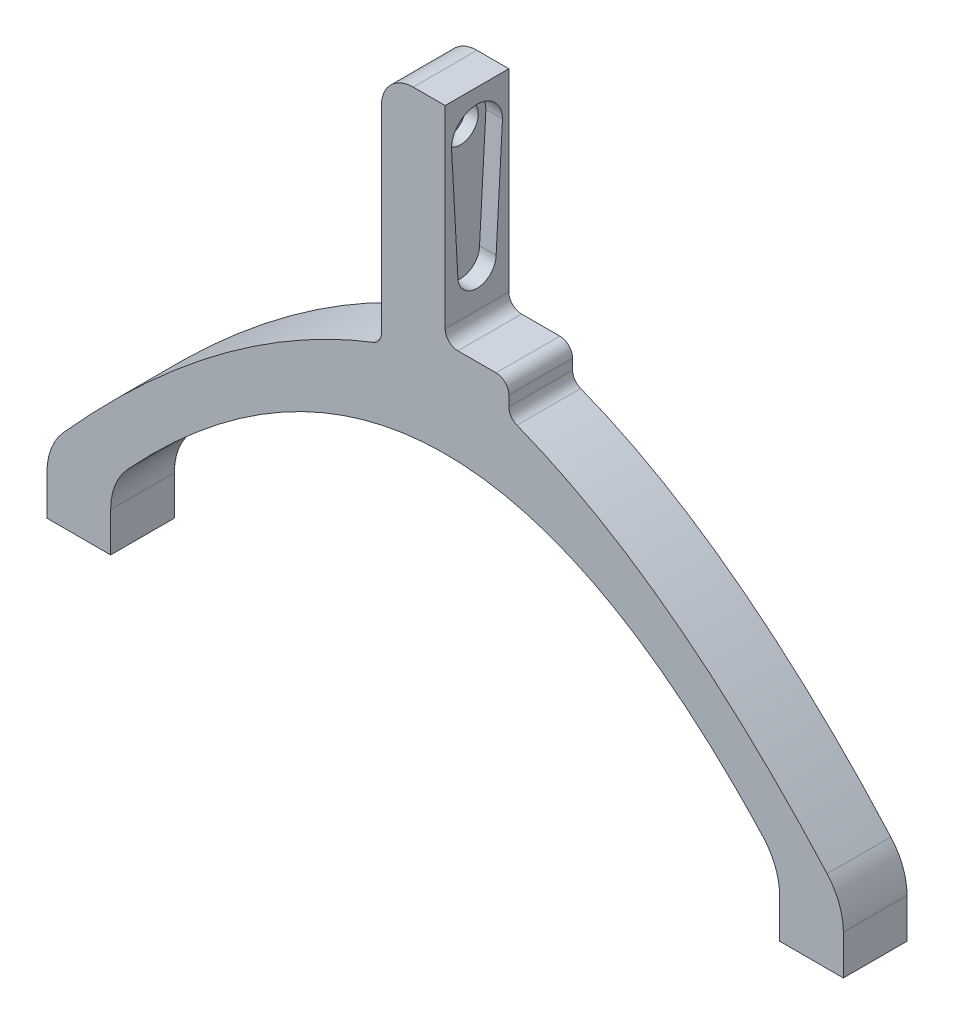
from build123d import *

# Parameters (mm, degrees)
SKETCH1_W                = 290
SKETCH1_H                = 260
BOSS_EXTRUDE1_DEPTH      = 8
BOSS_EXTRUDE2_DEPTH      = 6
CHAMFER1_SIZE            = 5
CHAMFER1_SIZE_2          = 6.399708161
SKETCH3_R                = 1.6
CUT_EXTRUDE1_DEPTH       = 5
SKETCH4_W                = 15
SKETCH4_H                = 25
SKETCH4_R                = 1.6
SKETCH4_W_2              = 25
SKETCH4_H_2              = 15
BOSS_EXTRUDE3_DEPTH      = 5
CUT_EXTRUDE2_DEPTH       = 0.25
BOSS_EXTRUDE4_DEPTH      = 7.5
BOSS_EXTRUDE4_DEPTH_BACK = 7.5
FILLET1_R                = 10
SKETCH7_R                = 2
SKETCH7_R_2              = 0.5
CUT_EXTRUDE3_DEPTH       = 8
SKETCH8_W                = 10
SKETCH8_H                = 10
BOSS_EXTRUDE5_DEPTH      = 10
BOSS_EXTRUDE6_DEPTH      = 10
FILLET2_R                = 10
SKETCH11_W               = 10
SKETCH11_H               = 32.342254785
CUT_EXTRUDE4_DEPTH       = 10
FILLET3_R                = 2
CUT_EXTRUDE6_DEPTH       = 2.6
FILLET4_R                = 5
SKETCH13_W               = 669.627497736
SKETCH13_H               = 418.517186084
CUT_EXTRUDE7_DEPTH       = 85
BOSS_EXTRUDE7_DEPTH      = 2
CUT_EXTRUDE8_DEPTH       = 2
CUT_EXTRUDE9_DEPTH       = 2.8
CUT_EXTRUDE10_DEPTH      = 8


with BuildPart() as part:
    # Sketch1 → Boss-Extrude1 (new body)
    with BuildSketch(Plane(origin=(0, 0, 0), x_dir=(1, 0, 0), z_dir=(0, 1, 0))):
        Rectangle(SKETCH1_W, SKETCH1_H)
        Polygon((-52.5, 130), (0, 130), (0, 160), (-22.5, 160), align=None)
        Polygon((0, 160), (0, 130), (52.5, 130), (22.5, 160), align=None)
    extrude(amount=BOSS_EXTRUDE1_DEPTH)

    # Sketch2 → Boss-Extrude2 (add)
    with BuildSketch(Plane(origin=(0, 8, 0), x_dir=(1, 0, 0), z_dir=(0, 1, 0))):
        Polygon((27.564101615, 25.4), (25.832050808, 28.4), (22.367949192, 28.4), (20.635898385, 25.4), (22.367949192, 22.4), (25.832050808, 22.4), align=None)
        Polygon((-20.635898385, 26.7), (-22.367949192, 29.7), (-25.832050808, 29.7), (-27.564101615, 26.7), (-25.832050808, 23.7), (-22.367949192, 23.7), align=None)
        Polygon((-15.535898385, -25.4), (-17.267949192, -22.4), (-20.732050808, -22.4), (-22.464101615, -25.4), (-20.732050808, -28.4), (-17.267949192, -28.4), align=None)
        Polygon((12.364101615, -25.4), (10.632050808, -22.4), (7.167949192, -22.4), (5.435898385, -25.4), (7.167949192, -28.4), (10.632050808, -28.4), align=None)
    extrude(amount=BOSS_EXTRUDE2_DEPTH)

    # Chamfer1
    # the kernel refuses this chamfer: 6.399708161, 5 mm, written as the material it adds along each edge
    with BuildSketch(Plane(origin=(-2.818240039, 8, 11.103412877), x_dir=(-0.8660254037844387, 0, 0.5), z_dir=(0.5, 0, 0.8660254037844387))) as chamfer1_piece_1_section:
        Polygon((CHAMFER1_SIZE, 0), (0, -CHAMFER1_SIZE_2), (0, 0), align=None)
    chamfer1_piece_1 = extrude(amount=36.480655312, mode=Mode.PRIVATE)
    chamfer1_piece_1 = split(chamfer1_piece_1, bisect_by=Plane(origin=(-2.818240039, 14, 11.103412877), z_dir=(0, -1, 0)), keep=Keep.TOP, mode=Mode.PRIVATE)
    chamfer1_piece_1 = split(chamfer1_piece_1, bisect_by=Plane(origin=(2.181166612, 3.489780623, 13.989821652), z_dir=(0.6824373310787425, -0.6156614753256566, 0.3940053768033616)), keep=Keep.TOP, mode=Mode.PRIVATE)
    chamfer1_piece_1 = split(chamfer1_piece_1, bisect_by=Plane(origin=(-2.818240039, 18.817141598, 24.948722749), z_dir=(0, -0.6156614753256563, -0.7880107536067237)), keep=Keep.TOP, mode=Mode.PRIVATE)
    add(chamfer1_piece_1)
    with BuildSketch(Plane(origin=(15.422087617, 8, 8.103412877), x_dir=(-0.8660254037844387, 0, -0.4999999999999999), z_dir=(-0.4999999999999999, 0, 0.8660254037844388))) as chamfer1_piece_2_section:
        Polygon((CHAMFER1_SIZE, 0), (0, -CHAMFER1_SIZE_2), (0, 0), align=None)
    chamfer1_piece_2 = extrude(amount=36.480655312, mode=Mode.PRIVATE)
    chamfer1_piece_2 = split(chamfer1_piece_2, bisect_by=Plane(origin=(15.422087617, 14, 8.103412877), z_dir=(0, -1, 0)), keep=Keep.TOP, mode=Mode.PRIVATE)
    chamfer1_piece_2 = split(chamfer1_piece_2, bisect_by=Plane(origin=(15.422087617, 3.489780623, 13.876230428), z_dir=(0, -0.6156614753256565, 0.7880107536067235)), keep=Keep.TOP, mode=Mode.PRIVATE)
    chamfer1_piece_2 = split(chamfer1_piece_2, bisect_by=Plane(origin=(3.431697543, 18.817141598, 15.026067813), z_dir=(0.6824373310787425, -0.6156614753256566, -0.3940053768033616)), keep=Keep.TOP, mode=Mode.PRIVATE)
    add(chamfer1_piece_2)
    with BuildSketch(Plane(origin=(27.140327656, 8, 22.4), x_dir=(0, 0, -1), z_dir=(-1, 0, 0))) as chamfer1_piece_3_section:
        Polygon((CHAMFER1_SIZE, 0), (0, -CHAMFER1_SIZE_2), (0, 0), align=None)
    chamfer1_piece_3 = extrude(amount=36.480655312, mode=Mode.PRIVATE)
    chamfer1_piece_3 = split(chamfer1_piece_3, bisect_by=Plane(origin=(27.140327656, 14, 22.4), z_dir=(0, -1, 0)), keep=Keep.TOP, mode=Mode.PRIVATE)
    chamfer1_piece_3 = split(chamfer1_piece_3, bisect_by=Plane(origin=(22.140921005, 3.489780623, 25.286408776), z_dir=(-0.6824373310787424, -0.6156614753256568, 0.39400537680336145)), keep=Keep.TOP, mode=Mode.PRIVATE)
    chamfer1_piece_3 = split(chamfer1_piece_3, bisect_by=Plane(origin=(15.149937583, 18.817141598, 15.477345064), z_dir=(0.6824373310787425, -0.6156614753256566, 0.3940053768033616)), keep=Keep.TOP, mode=Mode.PRIVATE)
    add(chamfer1_piece_3)
    with BuildSketch(Plane(origin=(20.618240039, 8, 39.696587123), x_dir=(0.8660254037844387, 0, -0.49999999999999983), z_dir=(-0.4999999999999998, 0, -0.8660254037844388))) as chamfer1_piece_4_section:
        Polygon((CHAMFER1_SIZE, 0), (0, -CHAMFER1_SIZE_2), (0, 0), align=None)
    chamfer1_piece_4 = extrude(amount=36.480655312, mode=Mode.PRIVATE)
    chamfer1_piece_4 = split(chamfer1_piece_4, bisect_by=Plane(origin=(20.618240039, 14, 39.696587123), z_dir=(0, -1, 0)), keep=Keep.TOP, mode=Mode.PRIVATE)
    chamfer1_piece_4 = split(chamfer1_piece_4, bisect_by=Plane(origin=(20.618240039, 18.817141598, 25.851277251), z_dir=(0, -0.6156614753256565, 0.7880107536067235)), keep=Keep.TOP, mode=Mode.PRIVATE)
    chamfer1_piece_4 = split(chamfer1_piece_4, bisect_by=Plane(origin=(15.618833388, 3.489780623, 36.810178348), z_dir=(-0.6824373310787425, -0.6156614753256566, -0.39400537680336156)), keep=Keep.TOP, mode=Mode.PRIVATE)
    add(chamfer1_piece_4)
    with BuildSketch(Plane(origin=(2.377912383, 8, 42.696587123), x_dir=(0.8660254037844387, 0, 0.4999999999999999), z_dir=(0.4999999999999999, 0, -0.8660254037844388))) as chamfer1_piece_5_section:
        Polygon((CHAMFER1_SIZE, 0), (0, -CHAMFER1_SIZE_2), (0, 0), align=None)
    chamfer1_piece_5 = extrude(amount=36.480655312, mode=Mode.PRIVATE)
    chamfer1_piece_5 = split(chamfer1_piece_5, bisect_by=Plane(origin=(2.377912383, 14, 42.696587123), z_dir=(0, -1, 0)), keep=Keep.TOP, mode=Mode.PRIVATE)
    chamfer1_piece_5 = split(chamfer1_piece_5, bisect_by=Plane(origin=(14.368302457, 18.817141598, 35.773932187), z_dir=(-0.6824373310787424, -0.6156614753256568, 0.39400537680336145)), keep=Keep.TOP, mode=Mode.PRIVATE)
    chamfer1_piece_5 = split(chamfer1_piece_5, bisect_by=Plane(origin=(2.377912383, 3.489780623, 36.923769572), z_dir=(0, -0.6156614753256563, -0.7880107536067237)), keep=Keep.TOP, mode=Mode.PRIVATE)
    add(chamfer1_piece_5)
    with BuildSketch(Plane(origin=(-9.340327656, 8, 28.4), x_dir=(0, 0, 1), z_dir=(1, 0, 0))) as chamfer1_piece_6_section:
        Polygon((CHAMFER1_SIZE, 0), (0, -CHAMFER1_SIZE_2), (0, 0), align=None)
    chamfer1_piece_6 = extrude(amount=36.480655312, mode=Mode.PRIVATE)
    chamfer1_piece_6 = split(chamfer1_piece_6, bisect_by=Plane(origin=(-9.340327656, 14, 28.4), z_dir=(0, -1, 0)), keep=Keep.TOP, mode=Mode.PRIVATE)
    chamfer1_piece_6 = split(chamfer1_piece_6, bisect_by=Plane(origin=(-4.340921005, 3.489780623, 25.513591224), z_dir=(0.6824373310787425, -0.6156614753256566, -0.3940053768033616)), keep=Keep.TOP, mode=Mode.PRIVATE)
    chamfer1_piece_6 = split(chamfer1_piece_6, bisect_by=Plane(origin=(2.650062417, 18.817141598, 35.322654936), z_dir=(-0.6824373310787425, -0.6156614753256566, -0.39400537680336156)), keep=Keep.TOP, mode=Mode.PRIVATE)
    add(chamfer1_piece_6)
    with BuildSketch(Plane(origin=(-37.240327656, 8, 28.4), x_dir=(0, 0, 1), z_dir=(1, 0, 0))) as chamfer1_piece_7_section:
        Polygon((CHAMFER1_SIZE, 0), (0, -CHAMFER1_SIZE_2), (0, 0), align=None)
    chamfer1_piece_7 = extrude(amount=36.480655312, mode=Mode.PRIVATE)
    chamfer1_piece_7 = split(chamfer1_piece_7, bisect_by=Plane(origin=(-37.240327656, 14, 28.4), z_dir=(0, -1, 0)), keep=Keep.TOP, mode=Mode.PRIVATE)
    chamfer1_piece_7 = split(chamfer1_piece_7, bisect_by=Plane(origin=(-25.249937583, 18.817141598, 35.322654936), z_dir=(-0.6824373310786762, -0.6156614753256564, -0.3940053768034766)), keep=Keep.TOP, mode=Mode.PRIVATE)
    chamfer1_piece_7 = split(chamfer1_piece_7, bisect_by=Plane(origin=(-32.240921005, 3.489780623, 25.513591224), z_dir=(0.6824373310787202, -0.6156614753256564, -0.3940053768034006)), keep=Keep.TOP, mode=Mode.PRIVATE)
    add(chamfer1_piece_7)
    with BuildSketch(Plane(origin=(-25.522087617, 8, 42.696587123), x_dir=(0.8660254037843544, 0, 0.5000000000001458), z_dir=(0.5000000000001458, 0, -0.8660254037843546))) as chamfer1_piece_8_section:
        Polygon((CHAMFER1_SIZE, 0), (0, -CHAMFER1_SIZE_2), (0, 0), align=None)
    chamfer1_piece_8 = extrude(amount=36.480655312, mode=Mode.PRIVATE)
    chamfer1_piece_8 = split(chamfer1_piece_8, bisect_by=Plane(origin=(-25.522087617, 14, 42.696587123), z_dir=(0, -1, 0)), keep=Keep.TOP, mode=Mode.PRIVATE)
    chamfer1_piece_8 = split(chamfer1_piece_8, bisect_by=Plane(origin=(-25.522087617, 3.489780623, 36.923769572), z_dir=(0, -0.6156614753256567, -0.7880107536067232)), keep=Keep.TOP, mode=Mode.PRIVATE)
    chamfer1_piece_8 = split(chamfer1_piece_8, bisect_by=Plane(origin=(-13.531697543, 18.817141598, 35.773932187), z_dir=(-0.6824373310787424, -0.6156614753256564, 0.39400537680336184)), keep=Keep.TOP, mode=Mode.PRIVATE)
    add(chamfer1_piece_8)
    with BuildSketch(Plane(origin=(-7.281759961, 8, 39.696587123), x_dir=(0.8660254037844386, 0, -0.5000000000000001), z_dir=(-0.5000000000000001, 0, -0.8660254037844386))) as chamfer1_piece_9_section:
        Polygon((CHAMFER1_SIZE, 0), (0, -CHAMFER1_SIZE_2), (0, 0), align=None)
    chamfer1_piece_9 = extrude(amount=36.480655312, mode=Mode.PRIVATE)
    chamfer1_piece_9 = split(chamfer1_piece_9, bisect_by=Plane(origin=(-7.281759961, 14, 39.696587123), z_dir=(0, -1, 0)), keep=Keep.TOP, mode=Mode.PRIVATE)
    chamfer1_piece_9 = split(chamfer1_piece_9, bisect_by=Plane(origin=(-12.281166612, 3.489780623, 36.810178348), z_dir=(-0.6824373310786762, -0.6156614753256564, -0.3940053768034766)), keep=Keep.TOP, mode=Mode.PRIVATE)
    chamfer1_piece_9 = split(chamfer1_piece_9, bisect_by=Plane(origin=(-7.281759961, 18.817141598, 25.851277251), z_dir=(1.6163362940315776e-14, -0.6156614753256565, 0.7880107536067235)), keep=Keep.TOP, mode=Mode.PRIVATE)
    add(chamfer1_piece_9)
    with BuildSketch(Plane(origin=(-0.759672344, 8, 22.4), x_dir=(0, 0, -1), z_dir=(-1, 0, 0))) as chamfer1_piece_10_section:
        Polygon((CHAMFER1_SIZE, 0), (0, -CHAMFER1_SIZE_2), (0, 0), align=None)
    chamfer1_piece_10 = extrude(amount=36.480655312, mode=Mode.PRIVATE)
    chamfer1_piece_10 = split(chamfer1_piece_10, bisect_by=Plane(origin=(-0.759672344, 14, 22.4), z_dir=(0, -1, 0)), keep=Keep.TOP, mode=Mode.PRIVATE)
    chamfer1_piece_10 = split(chamfer1_piece_10, bisect_by=Plane(origin=(-5.759078995, 3.489780623, 25.286408776), z_dir=(-0.6824373310787424, -0.6156614753256564, 0.39400537680336184)), keep=Keep.TOP, mode=Mode.PRIVATE)
    chamfer1_piece_10 = split(chamfer1_piece_10, bisect_by=Plane(origin=(-12.750062417, 18.817141598, 15.477345064), z_dir=(0.6824373310787266, -0.6156614753256564, 0.3940053768033893)), keep=Keep.TOP, mode=Mode.PRIVATE)
    add(chamfer1_piece_10)
    with BuildSketch(Plane(origin=(-12.477912383, 8, 8.103412877), x_dir=(-0.8660254037844184, 0, -0.500000000000035), z_dir=(-0.500000000000035, 0, 0.8660254037844185))) as chamfer1_piece_11_section:
        Polygon((CHAMFER1_SIZE, 0), (0, -CHAMFER1_SIZE_2), (0, 0), align=None)
    chamfer1_piece_11 = extrude(amount=36.480655312, mode=Mode.PRIVATE)
    chamfer1_piece_11 = split(chamfer1_piece_11, bisect_by=Plane(origin=(-12.477912383, 14, 8.103412877), z_dir=(0, -1, 0)), keep=Keep.TOP, mode=Mode.PRIVATE)
    chamfer1_piece_11 = split(chamfer1_piece_11, bisect_by=Plane(origin=(-12.477912383, 3.489780623, 13.876230428), z_dir=(1.6163362940315776e-14, -0.6156614753256565, 0.7880107536067235)), keep=Keep.TOP, mode=Mode.PRIVATE)
    chamfer1_piece_11 = split(chamfer1_piece_11, bisect_by=Plane(origin=(-24.468302457, 18.817141598, 15.026067813), z_dir=(0.6824373310787202, -0.6156614753256564, -0.3940053768034006)), keep=Keep.TOP, mode=Mode.PRIVATE)
    add(chamfer1_piece_11)
    with BuildSketch(Plane(origin=(-30.718240039, 8, 11.103412877), x_dir=(-0.8660254037844104, 0, 0.5000000000000491), z_dir=(0.5000000000000491, 0, 0.8660254037844103))) as chamfer1_piece_12_section:
        Polygon((CHAMFER1_SIZE, 0), (0, -CHAMFER1_SIZE_2), (0, 0), align=None)
    chamfer1_piece_12 = extrude(amount=36.480655312, mode=Mode.PRIVATE)
    chamfer1_piece_12 = split(chamfer1_piece_12, bisect_by=Plane(origin=(-30.718240039, 14, 11.103412877), z_dir=(0, -1, 0)), keep=Keep.TOP, mode=Mode.PRIVATE)
    chamfer1_piece_12 = split(chamfer1_piece_12, bisect_by=Plane(origin=(-30.718240039, 18.817141598, 24.948722749), z_dir=(0, -0.6156614753256567, -0.7880107536067232)), keep=Keep.TOP, mode=Mode.PRIVATE)
    chamfer1_piece_12 = split(chamfer1_piece_12, bisect_by=Plane(origin=(-25.718833388, 3.489780623, 13.989821652), z_dir=(0.6824373310787266, -0.6156614753256564, 0.3940053768033893)), keep=Keep.TOP, mode=Mode.PRIVATE)
    add(chamfer1_piece_12)
    with BuildSketch(Plane(origin=(30.622087617, 8, -42.696587123), x_dir=(-0.8660254037844389, 0, -0.49999999999999956), z_dir=(-0.4999999999999995, 0, 0.8660254037844389))) as chamfer1_piece_13_section:
        Polygon((CHAMFER1_SIZE, 0), (0, -CHAMFER1_SIZE_2), (0, 0), align=None)
    chamfer1_piece_13 = extrude(amount=36.480655312, mode=Mode.PRIVATE)
    chamfer1_piece_13 = split(chamfer1_piece_13, bisect_by=Plane(origin=(30.622087617, 14, -42.696587123), z_dir=(0, -1, 0)), keep=Keep.TOP, mode=Mode.PRIVATE)
    chamfer1_piece_13 = split(chamfer1_piece_13, bisect_by=Plane(origin=(18.631697543, 18.817141598, -35.773932187), z_dir=(0.6824373310787425, -0.6156614753256566, -0.3940053768033616)), keep=Keep.TOP, mode=Mode.PRIVATE)
    chamfer1_piece_13 = split(chamfer1_piece_13, bisect_by=Plane(origin=(30.622087617, 3.489780623, -36.923769572), z_dir=(0, -0.6156614753256565, 0.7880107536067235)), keep=Keep.TOP, mode=Mode.PRIVATE)
    add(chamfer1_piece_13)
    with BuildSketch(Plane(origin=(12.381759961, 8, -39.696587123), x_dir=(-0.8660254037844387, 0, 0.4999999999999999), z_dir=(0.4999999999999999, 0, 0.8660254037844388))) as chamfer1_piece_14_section:
        Polygon((CHAMFER1_SIZE, 0), (0, -CHAMFER1_SIZE_2), (0, 0), align=None)
    chamfer1_piece_14 = extrude(amount=36.480655312, mode=Mode.PRIVATE)
    chamfer1_piece_14 = split(chamfer1_piece_14, bisect_by=Plane(origin=(12.381759961, 14, -39.696587123), z_dir=(0, -1, 0)), keep=Keep.TOP, mode=Mode.PRIVATE)
    chamfer1_piece_14 = split(chamfer1_piece_14, bisect_by=Plane(origin=(17.381166612, 3.489780623, -36.810178348), z_dir=(0.6824373310787428, -0.6156614753256567, 0.39400537680336145)), keep=Keep.TOP, mode=Mode.PRIVATE)
    chamfer1_piece_14 = split(chamfer1_piece_14, bisect_by=Plane(origin=(12.381759961, 18.817141598, -25.851277251), z_dir=(0, -0.6156614753256565, -0.7880107536067235)), keep=Keep.TOP, mode=Mode.PRIVATE)
    add(chamfer1_piece_14)
    with BuildSketch(Plane(origin=(5.859672344, 8, -22.4), x_dir=(0, 0, 1), z_dir=(1, 0, 0))) as chamfer1_piece_15_section:
        Polygon((CHAMFER1_SIZE, 0), (0, -CHAMFER1_SIZE_2), (0, 0), align=None)
    chamfer1_piece_15 = extrude(amount=36.480655312, mode=Mode.PRIVATE)
    chamfer1_piece_15 = split(chamfer1_piece_15, bisect_by=Plane(origin=(5.859672344, 14, -22.4), z_dir=(0, -1, 0)), keep=Keep.TOP, mode=Mode.PRIVATE)
    chamfer1_piece_15 = split(chamfer1_piece_15, bisect_by=Plane(origin=(10.859078995, 3.489780623, -25.286408776), z_dir=(0.6824373310787425, -0.6156614753256566, -0.3940053768033616)), keep=Keep.TOP, mode=Mode.PRIVATE)
    chamfer1_piece_15 = split(chamfer1_piece_15, bisect_by=Plane(origin=(17.850062417, 18.817141598, -15.477345064), z_dir=(-0.6824373310787426, -0.6156614753256564, -0.39400537680336173)), keep=Keep.TOP, mode=Mode.PRIVATE)
    add(chamfer1_piece_15)
    with BuildSketch(Plane(origin=(17.577912383, 8, -8.103412877), x_dir=(0.8660254037844387, 0, 0.4999999999999999), z_dir=(0.4999999999999999, 0, -0.8660254037844388))) as chamfer1_piece_16_section:
        Polygon((CHAMFER1_SIZE, 0), (0, -CHAMFER1_SIZE_2), (0, 0), align=None)
    chamfer1_piece_16 = extrude(amount=36.480655312, mode=Mode.PRIVATE)
    chamfer1_piece_16 = split(chamfer1_piece_16, bisect_by=Plane(origin=(17.577912383, 14, -8.103412877), z_dir=(0, -1, 0)), keep=Keep.TOP, mode=Mode.PRIVATE)
    chamfer1_piece_16 = split(chamfer1_piece_16, bisect_by=Plane(origin=(17.577912383, 3.489780623, -13.876230428), z_dir=(0, -0.6156614753256565, -0.7880107536067235)), keep=Keep.TOP, mode=Mode.PRIVATE)
    chamfer1_piece_16 = split(chamfer1_piece_16, bisect_by=Plane(origin=(29.568302457, 18.817141598, -15.026067813), z_dir=(-0.6824373310787424, -0.6156614753256564, 0.3940053768033619)), keep=Keep.TOP, mode=Mode.PRIVATE)
    add(chamfer1_piece_16)
    with BuildSketch(Plane(origin=(35.818240039, 8, -11.103412877), x_dir=(0.8660254037844385, 0, -0.5000000000000002), z_dir=(-0.5000000000000003, 0, -0.8660254037844386))) as chamfer1_piece_17_section:
        Polygon((CHAMFER1_SIZE, 0), (0, -CHAMFER1_SIZE_2), (0, 0), align=None)
    chamfer1_piece_17 = extrude(amount=36.480655312, mode=Mode.PRIVATE)
    chamfer1_piece_17 = split(chamfer1_piece_17, bisect_by=Plane(origin=(35.818240039, 14, -11.103412877), z_dir=(0, -1, 0)), keep=Keep.TOP, mode=Mode.PRIVATE)
    chamfer1_piece_17 = split(chamfer1_piece_17, bisect_by=Plane(origin=(30.818833388, 3.489780623, -13.989821652), z_dir=(-0.6824373310787426, -0.6156614753256564, -0.39400537680336173)), keep=Keep.TOP, mode=Mode.PRIVATE)
    chamfer1_piece_17 = split(chamfer1_piece_17, bisect_by=Plane(origin=(35.818240039, 18.817141598, -24.948722749), z_dir=(0, -0.6156614753256565, 0.7880107536067235)), keep=Keep.TOP, mode=Mode.PRIVATE)
    add(chamfer1_piece_17)
    with BuildSketch(Plane(origin=(42.340327656, 8, -28.4), x_dir=(0, 0, -1), z_dir=(-1, 0, 0))) as chamfer1_piece_18_section:
        Polygon((CHAMFER1_SIZE, 0), (0, -CHAMFER1_SIZE_2), (0, 0), align=None)
    chamfer1_piece_18 = extrude(amount=36.480655312, mode=Mode.PRIVATE)
    chamfer1_piece_18 = split(chamfer1_piece_18, bisect_by=Plane(origin=(42.340327656, 14, -28.4), z_dir=(0, -1, 0)), keep=Keep.TOP, mode=Mode.PRIVATE)
    chamfer1_piece_18 = split(chamfer1_piece_18, bisect_by=Plane(origin=(30.349937583, 18.817141598, -35.322654936), z_dir=(0.6824373310787428, -0.6156614753256567, 0.39400537680336145)), keep=Keep.TOP, mode=Mode.PRIVATE)
    chamfer1_piece_18 = split(chamfer1_piece_18, bisect_by=Plane(origin=(37.340921005, 3.489780623, -25.513591224), z_dir=(-0.6824373310787424, -0.6156614753256564, 0.3940053768033619)), keep=Keep.TOP, mode=Mode.PRIVATE)
    add(chamfer1_piece_18)
    with BuildSketch(Plane(origin=(-17.577912383, 8, -43.996587123), x_dir=(-0.8660254037844387, 0, -0.4999999999999999), z_dir=(-0.4999999999999999, 0, 0.8660254037844388))) as chamfer1_piece_19_section:
        Polygon((CHAMFER1_SIZE, 0), (0, -CHAMFER1_SIZE_2), (0, 0), align=None)
    chamfer1_piece_19 = extrude(amount=36.480655312, mode=Mode.PRIVATE)
    chamfer1_piece_19 = split(chamfer1_piece_19, bisect_by=Plane(origin=(-17.577912383, 14, -43.996587123), z_dir=(0, -1, 0)), keep=Keep.TOP, mode=Mode.PRIVATE)
    chamfer1_piece_19 = split(chamfer1_piece_19, bisect_by=Plane(origin=(-17.577912383, 3.489780623, -38.223769572), z_dir=(0, -0.6156614753256565, 0.7880107536067235)), keep=Keep.TOP, mode=Mode.PRIVATE)
    chamfer1_piece_19 = split(chamfer1_piece_19, bisect_by=Plane(origin=(-29.568302457, 18.817141598, -37.073932187), z_dir=(0.6824373310787425, -0.6156614753256564, -0.394005376803362)), keep=Keep.TOP, mode=Mode.PRIVATE)
    add(chamfer1_piece_19)
    with BuildSketch(Plane(origin=(-5.859672344, 8, -29.7), x_dir=(0, 0, -1), z_dir=(-1, 0, 0))) as chamfer1_piece_20_section:
        Polygon((CHAMFER1_SIZE, 0), (0, -CHAMFER1_SIZE_2), (0, 0), align=None)
    chamfer1_piece_20 = extrude(amount=36.480655312, mode=Mode.PRIVATE)
    chamfer1_piece_20 = split(chamfer1_piece_20, bisect_by=Plane(origin=(-5.859672344, 14, -29.7), z_dir=(0, -1, 0)), keep=Keep.TOP, mode=Mode.PRIVATE)
    chamfer1_piece_20 = split(chamfer1_piece_20, bisect_by=Plane(origin=(-10.859078995, 3.489780623, -26.813591224), z_dir=(-0.682437331078742, -0.6156614753256566, 0.39400537680336195)), keep=Keep.TOP, mode=Mode.PRIVATE)
    chamfer1_piece_20 = split(chamfer1_piece_20, bisect_by=Plane(origin=(-17.850062417, 18.817141598, -36.622654936), z_dir=(0.6824373310787424, -0.615661475325657, 0.3940053768033615)), keep=Keep.TOP, mode=Mode.PRIVATE)
    add(chamfer1_piece_20)
    with BuildSketch(Plane(origin=(-12.381759961, 8, -12.403412877), x_dir=(0.8660254037844385, 0, -0.5000000000000004), z_dir=(-0.5000000000000004, 0, -0.8660254037844385))) as chamfer1_piece_21_section:
        Polygon((CHAMFER1_SIZE, 0), (0, -CHAMFER1_SIZE_2), (0, 0), align=None)
    chamfer1_piece_21 = extrude(amount=36.480655312, mode=Mode.PRIVATE)
    chamfer1_piece_21 = split(chamfer1_piece_21, bisect_by=Plane(origin=(-12.381759961, 14, -12.403412877), z_dir=(0, -1, 0)), keep=Keep.TOP, mode=Mode.PRIVATE)
    chamfer1_piece_21 = split(chamfer1_piece_21, bisect_by=Plane(origin=(-12.381759961, 18.817141598, -26.248722749), z_dir=(0, -0.6156614753256565, 0.7880107536067235)), keep=Keep.TOP, mode=Mode.PRIVATE)
    chamfer1_piece_21 = split(chamfer1_piece_21, bisect_by=Plane(origin=(-17.381166612, 3.489780623, -15.289821652), z_dir=(-0.6824373310787428, -0.6156614753256568, -0.39400537680336084)), keep=Keep.TOP, mode=Mode.PRIVATE)
    add(chamfer1_piece_21)
    with BuildSketch(Plane(origin=(-30.622087617, 8, -9.403412877), x_dir=(0.8660254037844393, 0, 0.49999999999999895), z_dir=(0.499999999999999, 0, -0.8660254037844394))) as chamfer1_piece_22_section:
        Polygon((CHAMFER1_SIZE, 0), (0, -CHAMFER1_SIZE_2), (0, 0), align=None)
    chamfer1_piece_22 = extrude(amount=36.480655312, mode=Mode.PRIVATE)
    chamfer1_piece_22 = split(chamfer1_piece_22, bisect_by=Plane(origin=(-30.622087617, 14, -9.403412877), z_dir=(0, -1, 0)), keep=Keep.TOP, mode=Mode.PRIVATE)
    chamfer1_piece_22 = split(chamfer1_piece_22, bisect_by=Plane(origin=(-18.631697543, 18.817141598, -16.326067813), z_dir=(-0.682437331078742, -0.6156614753256566, 0.39400537680336195)), keep=Keep.TOP, mode=Mode.PRIVATE)
    chamfer1_piece_22 = split(chamfer1_piece_22, bisect_by=Plane(origin=(-30.622087617, 3.489780623, -15.176230428), z_dir=(0, -0.6156614753256565, -0.7880107536067235)), keep=Keep.TOP, mode=Mode.PRIVATE)
    add(chamfer1_piece_22)
    with BuildSketch(Plane(origin=(-42.340327656, 8, -23.7), x_dir=(0, 0, 1), z_dir=(1, 0, 0))) as chamfer1_piece_23_section:
        Polygon((CHAMFER1_SIZE, 0), (0, -CHAMFER1_SIZE_2), (0, 0), align=None)
    chamfer1_piece_23 = extrude(amount=36.480655312, mode=Mode.PRIVATE)
    chamfer1_piece_23 = split(chamfer1_piece_23, bisect_by=Plane(origin=(-42.340327656, 14, -23.7), z_dir=(0, -1, 0)), keep=Keep.TOP, mode=Mode.PRIVATE)
    chamfer1_piece_23 = split(chamfer1_piece_23, bisect_by=Plane(origin=(-37.340921005, 3.489780623, -26.586408776), z_dir=(0.6824373310787425, -0.6156614753256564, -0.394005376803362)), keep=Keep.TOP, mode=Mode.PRIVATE)
    chamfer1_piece_23 = split(chamfer1_piece_23, bisect_by=Plane(origin=(-30.349937583, 18.817141598, -16.777345064), z_dir=(-0.6824373310787428, -0.6156614753256568, -0.39400537680336084)), keep=Keep.TOP, mode=Mode.PRIVATE)
    add(chamfer1_piece_23)
    with BuildSketch(Plane(origin=(-35.818240039, 8, -40.996587123), x_dir=(-0.8660254037844385, 0, 0.5000000000000002), z_dir=(0.5000000000000003, 0, 0.8660254037844386))) as chamfer1_piece_24_section:
        Polygon((CHAMFER1_SIZE, 0), (0, -CHAMFER1_SIZE_2), (0, 0), align=None)
    chamfer1_piece_24 = extrude(amount=36.480655312, mode=Mode.PRIVATE)
    chamfer1_piece_24 = split(chamfer1_piece_24, bisect_by=Plane(origin=(-35.818240039, 14, -40.996587123), z_dir=(0, -1, 0)), keep=Keep.TOP, mode=Mode.PRIVATE)
    chamfer1_piece_24 = split(chamfer1_piece_24, bisect_by=Plane(origin=(-30.818833388, 3.489780623, -38.110178348), z_dir=(0.6824373310787424, -0.615661475325657, 0.3940053768033615)), keep=Keep.TOP, mode=Mode.PRIVATE)
    chamfer1_piece_24 = split(chamfer1_piece_24, bisect_by=Plane(origin=(-35.818240039, 18.817141598, -27.151277251), z_dir=(0, -0.6156614753256565, -0.7880107536067235)), keep=Keep.TOP, mode=Mode.PRIVATE)
    add(chamfer1_piece_24)

    # Sketch3 → Cut-Extrude1 (cut)
    with BuildSketch(Plane(origin=(0, 14, 0), x_dir=(1, 0, 0), z_dir=(0, 1, 0))):
        with Locations(Location((24.1, 25.4, 0), (0, 0, 270))):
            Circle(SKETCH3_R)
        with Locations(Location((-19, -25.4, 0), (0, 0, 270))):
            Circle(SKETCH3_R)
        with Locations(Location((8.9, -25.4, 0), (0, 0, 270))):
            Circle(SKETCH3_R)
        with Locations(Location((-24.1, 26.7, 0), (0, 0, 270))):
            Circle(SKETCH3_R)
    extrude(amount=-CUT_EXTRUDE1_DEPTH, mode=Mode.SUBTRACT)

    # Sketch4 → Boss-Extrude3 (add)
    # profile 1 of 3: a face of its own
    with BuildSketch(Plane(origin=(0, 8, 0), x_dir=(1, 0, 0), z_dir=(0, 1, 0))):
        with Locations((80, 0)):
            Rectangle(SKETCH4_W, SKETCH4_H)
        with Locations(Location((83.75, 0, 0), (0, 0, 270))):
            Circle(SKETCH4_R, mode=Mode.SUBTRACT)
    # profile 2 of 3: a face of its own
    with BuildSketch(Plane(origin=(0, 8, 0), x_dir=(1, 0, 0), z_dir=(0, 1, 0))):
        with Locations((0, -80)):
            Rectangle(SKETCH4_W_2, SKETCH4_H_2)
        with Locations(Location((0, -83.75, 0), (0, 0, 270))):
            Circle(SKETCH4_R, mode=Mode.SUBTRACT)
    # profile 3 of 3: a face of its own
    with BuildSketch(Plane(origin=(0, 8, 0), x_dir=(1, 0, 0), z_dir=(0, 1, 0))):
        with Locations((-80, 0)):
            Rectangle(SKETCH4_W, SKETCH4_H)
        with Locations(Location((-83.75, 0, 0), (0, 0, 270))):
            Circle(SKETCH4_R, mode=Mode.SUBTRACT)
    extrude(amount=BOSS_EXTRUDE3_DEPTH)

    # Sketch5 → Cut-Extrude2 (cut)
    with BuildSketch(Plane(origin=(0, 8, 0), x_dir=(1, 0, 0), z_dir=(0, 1, 0))):
        with BuildLine():
            Line((-80.029681994, 12.5), (-80, 12.5))
            Line((-80, 12.5), (-78.004807544, 12.5))
            ThreePointArc((-78.004807544, 12.5), (0, 79), (78.004807544, 12.5))
            Line((78.004807544, 12.5), (80, 12.5))
            Line((80, 12.5), (80.029681994, 12.5))
            ThreePointArc((80.029681994, 12.5), (0, 81), (-80.029681994, 12.5))
        make_face()
        with BuildLine():
            ThreePointArc((-12.5, -78.004807544), (-55.861435714, -55.861435714), (-78.004807544, -12.5))
            Line((-78.004807544, -12.5), (-80, -12.5))
            Line((-80, -12.5), (-80.029681994, -12.5))
            ThreePointArc((-80.029681994, -12.5), (-57.275649276, -57.275649276), (-12.5, -80.029681994))
            Line((-12.5, -80.029681994), (-12.5, -80))
            Line((-12.5, -80), (-12.5, -78.004807544))
        make_face()
        with BuildLine():
            Line((80, -12.5), (78.004807544, -12.5))
            ThreePointArc((78.004807544, -12.5), (55.861435714, -55.861435714), (12.5, -78.004807544))
            Line((12.5, -78.004807544), (12.5, -80))
            Line((12.5, -80), (12.5, -80.029681994))
            ThreePointArc((12.5, -80.029681994), (57.275649276, -57.275649276), (80.029681994, -12.5))
            Line((80.029681994, -12.5), (80, -12.5))
        make_face()
    extrude(amount=-CUT_EXTRUDE2_DEPTH, mode=Mode.SUBTRACT)

    # Sketch6 → Boss-Extrude4 (add, two sides: drawn at the far end of the back side and taken through both)
    with BuildSketch(Plane(origin=(0, 0, -100), x_dir=(-1, 0, 0), z_dir=(0, 0, -1)).offset(-BOSS_EXTRUDE4_DEPTH_BACK)):
        with BuildLine():
            Line((-17.5, 8), (-12.5, 8))
            ThreePointArc((-12.5, 8), (0, 20.5), (12.5, 8))
            Line((12.5, 8), (17.5, 8))
            ThreePointArc((17.5, 8), (0, 25.5), (-17.5, 8))
        make_face()
    extrude(amount=BOSS_EXTRUDE4_DEPTH + BOSS_EXTRUDE4_DEPTH_BACK)

    # Fillet1
    fillet1_edges = [part.edges().sort_by_distance(p)[0] for p in [
        (-17.5, 8, -100),
        (17.5, 8, -100),
    ]]
    fillet(fillet1_edges, radius=FILLET1_R)

    # Sketch7 → Cut-Extrude3 (cut)
    with BuildSketch(Plane.XZ):
        with Locations(Location((11.25, -145, 0), (0, 0, 270))):
            Circle(SKETCH7_R)
        with Locations(Location((6.035533906, -138.964466094, 0), (0, 0, 270))):
            Circle(SKETCH7_R_2)
        with Locations(Location((4.621320344, -140.378679656, 0), (0, 0, 270))):
            Circle(SKETCH7_R_2)
        with Locations(Location((0, -145, 0), (0, 0, 270))):
            Circle(SKETCH7_R)
        with Locations(Location((-11.25, -145, 0), (0, 0, 270))):
            Circle(SKETCH7_R)
        with Locations(Location((0, -133.75, 0), (0, 0, 270))):
            Circle(SKETCH7_R)
        with Locations(Location((0, -156.25, 0), (0, 0, 270))):
            Circle(SKETCH7_R)
        with Locations(Location((6.035533906, -151.035533906, 0), (0, 0, 90))):
            Circle(SKETCH7_R_2)
        with Locations(Location((4.621320344, -149.621320344, 0), (0, 0, 270))):
            Circle(SKETCH7_R_2)
        with Locations(Location((-6.035533906, -151.035533906, 0), (0, 0, 270))):
            Circle(SKETCH7_R_2)
        with Locations(Location((-4.621320344, -149.621320344, 0), (0, 0, 270))):
            Circle(SKETCH7_R_2)
        with Locations(Location((-6.035533906, -138.964466094, 0), (0, 0, 90))):
            Circle(SKETCH7_R_2)
        with Locations(Location((-4.621320344, -140.378679656, 0), (0, 0, 90))):
            Circle(SKETCH7_R_2)
    extrude(amount=-CUT_EXTRUDE3_DEPTH, mode=Mode.SUBTRACT)

    # Sketch8 → Boss-Extrude5 (add)
    with BuildSketch(Plane(origin=(0, 8, 0), x_dir=(1, 0, 0), z_dir=(0, 1, 0))):
        with Locations((-57.5, 0)):
            Rectangle(SKETCH8_W, SKETCH8_H)
        with Locations((57.5, 0)):
            Rectangle(SKETCH8_W, SKETCH8_H)
    extrude(amount=BOSS_EXTRUDE5_DEPTH)

    # Sketch10 → Boss-Extrude6 (add)
    with BuildSketch(Plane.XY.offset(5)):
        with BuildLine():
            Line((-10, 95.342254785), (-10, 58))
            add(Edge.make_bspline(
                [(-62.5, 18), (-36.25, 48.308909658), (-10, 58)],
                knots=[0, 0, 0, 0.42, 0.42, 0.42], degree=2))
            Line((-62.5, 18), (-52.5, 18))
            add(Edge.make_bspline(
                [(-52.5, 18), (-41.405444566, 30.679491924), (-30.310889132, 38)],
                knots=[0, 0, 0, 0.211324865, 0.211324865, 0.211324865], degree=2))
            add(Edge.make_bspline(
                [(-30.310889132, 38), (0, 58), (30.310889132, 38)],
                knots=[0.211324865, 0.211324865, 0.211324865, 0.788675135, 0.788675135, 0.788675135], degree=2))
            add(Edge.make_bspline(
                [(30.310889132, 38), (41.405444566, 30.679491924), (52.5, 18)],
                knots=[0.788675135, 0.788675135, 0.788675135, 1, 1, 1], degree=2))
            Line((52.5, 18), (62.5, 18))
            add(Edge.make_bspline(
                [(10, 58), (36.25, 48.308909658), (62.5, 18)],
                knots=[0.58, 0.58, 0.58, 1, 1, 1], degree=2))
            Line((10, 58), (10, 95.342254785))
            Line((10, 95.342254785), (-10, 95.342254785))
        make_face()
    extrude(amount=-BOSS_EXTRUDE6_DEPTH)

    # Fillet2
    fillet2_edges = [part.edges().sort_by_distance(p)[0] for p in [
        (62.5, 18, 0),
        (52.5, 18, 0),
        (-52.5, 18, 0),
        (-62.5, 18, 0),
    ]]
    fillet(fillet2_edges, radius=FILLET2_R)

    # Sketch11 → Cut-Extrude4 (cut)
    with BuildSketch(Plane(origin=(10, 0, 0), x_dir=(0, 0, -1), z_dir=(1, 0, 0))):
        with Locations((0, 79.171127393)):
            Rectangle(SKETCH11_W, SKETCH11_H)
    extrude(amount=-CUT_EXTRUDE4_DEPTH, mode=Mode.SUBTRACT)

    # Fillet3
    fillet3_edges = [part.edges().sort_by_distance(p)[0] for p in [
        (10, 58, 0),
        (-10, 58, 0),
        (0, 63, 0),
        (10, 63, 0),
    ]]
    fillet(fillet3_edges, radius=FILLET3_R)

    # Sketch12 → Cut-Extrude6 (cut)
    with BuildSketch(Plane(origin=(0, 0, 0), x_dir=(0, 0, -1), z_dir=(1, 0, 0))):
        with BuildLine():
            Line((-3.975384615, 88.556923077), (-3, 71))
            ThreePointArc((-3, 71), (-2.121320344, 68.878679656), (0, 68))
            ThreePointArc((0, 68), (2.121320344, 68.878679656), (3, 71))
            Line((3, 71), (3.975384615, 88.556923077))
            Line((3.975384615, 88.556923077), (4, 89))
            ThreePointArc((4, 89), (0, 93), (-4, 89))
            Line((-4, 89), (-3.975384615, 88.556923077))
        make_face()
    extrude(amount=-CUT_EXTRUDE6_DEPTH, mode=Mode.SUBTRACT)

    # Fillet4
    fillet4_edges = [part.edges().sort_by_distance(p)[0] for p in [
        (-10, 95.342254785, 0),
    ]]
    fillet(fillet4_edges, radius=FILLET4_R)

    # Sketch13 → Cut-Extrude7 (cut)
    with BuildSketch(Plane(origin=(0, 8, 0), x_dir=(1, 0, 0), z_dir=(0, 1, 0))):
        with Locations((-40.089540983, -23.107091154)):
            Rectangle(SKETCH13_W, SKETCH13_H)
    extrude(amount=-CUT_EXTRUDE7_DEPTH, mode=Mode.SUBTRACT)


with BuildPart() as body_2:
    # of the pieces the cut leaves, the one that is kept (cut_extrude7_keep)
    add(part.part.solids().sort_by_distance((-5, 95.342254785, -5))[0])

    # Sketch14 → Boss-Extrude7 (add)
    with BuildSketch(Plane(origin=(-2.6, 0, 0), x_dir=(0, 0, -1), z_dir=(1, 0, 0))):
        with BuildLine():
            ThreePointArc((2.8, 89), (0, 91.8), (-2.8, 89))
            Line((-2.8, 89), (2.8, 89))
        make_face()
        with BuildLine():
            Line((2.8, 89), (-2.8, 89))
            ThreePointArc((-2.8, 89), (0, 86.2), (2.8, 89))
        make_face()
    extrude(amount=-BOSS_EXTRUDE7_DEPTH)

    # Sketch15 → Cut-Extrude8 (cut)
    with BuildSketch(Plane(origin=(-2.6, 0, 0), x_dir=(0, 0, -1), z_dir=(1, 0, 0))):
        with BuildLine():
            ThreePointArc((2.8, 89), (0, 91.8), (-2.8, 89))
            Line((-2.8, 89), (2.8, 89))
        make_face()
        with BuildLine():
            Line((2.8, 89), (-2.8, 89))
            ThreePointArc((-2.8, 89), (0, 86.2), (2.8, 89))
        make_face()
    extrude(amount=-CUT_EXTRUDE8_DEPTH, mode=Mode.SUBTRACT)

    # Sketch16 → Cut-Extrude9 (cut)
    with BuildSketch(Plane.XZ.offset(-8)):
        Polygon((60.964101615, 0), (59.232050808, 3), (55.767949192, 3), (54.035898385, 0), (55.767949192, -3), (59.232050808, -3), align=None)
        Polygon((-54.035898385, 0), (-55.767949192, 3), (-59.232050808, 3), (-60.964101615, 0), (-59.232050808, -3), (-55.767949192, -3), align=None)
    extrude(amount=-CUT_EXTRUDE9_DEPTH, mode=Mode.SUBTRACT)

    # Sketch17 → Cut-Extrude10 (cut)
    with BuildSketch(Plane.XZ.offset(-10.8)):
        with BuildLine():
            ThreePointArc((59.05, 0), (58.275, 1.342339376), (56.725, 1.342339376))
            Line((56.725, 1.342339376), (58.275, -1.342339376))
            ThreePointArc((58.275, -1.342339376), (58.842339376, -0.775), (59.05, 0))
        make_face()
        with BuildLine():
            Line((58.275, -1.342339376), (56.725, 1.342339376))
            ThreePointArc((56.725, 1.342339376), (56.157660624, -0.775), (58.275, -1.342339376))
        make_face()
        with BuildLine():
            ThreePointArc((-58.275, 1.342339376), (-58.842339376, -0.775), (-56.725, -1.342339376))
            Line((-56.725, -1.342339376), (-58.275, 1.342339376))
        make_face()
        with BuildLine():
            Line((-58.275, 1.342339376), (-56.725, -1.342339376))
            ThreePointArc((-56.725, -1.342339376), (-56.157660624, -0.775), (-55.95, 0))
            ThreePointArc((-55.95, 0), (-56.725, 1.342339376), (-58.275, 1.342339376))
        make_face()
    extrude(amount=-CUT_EXTRUDE10_DEPTH, mode=Mode.SUBTRACT)


solid = body_2.part
